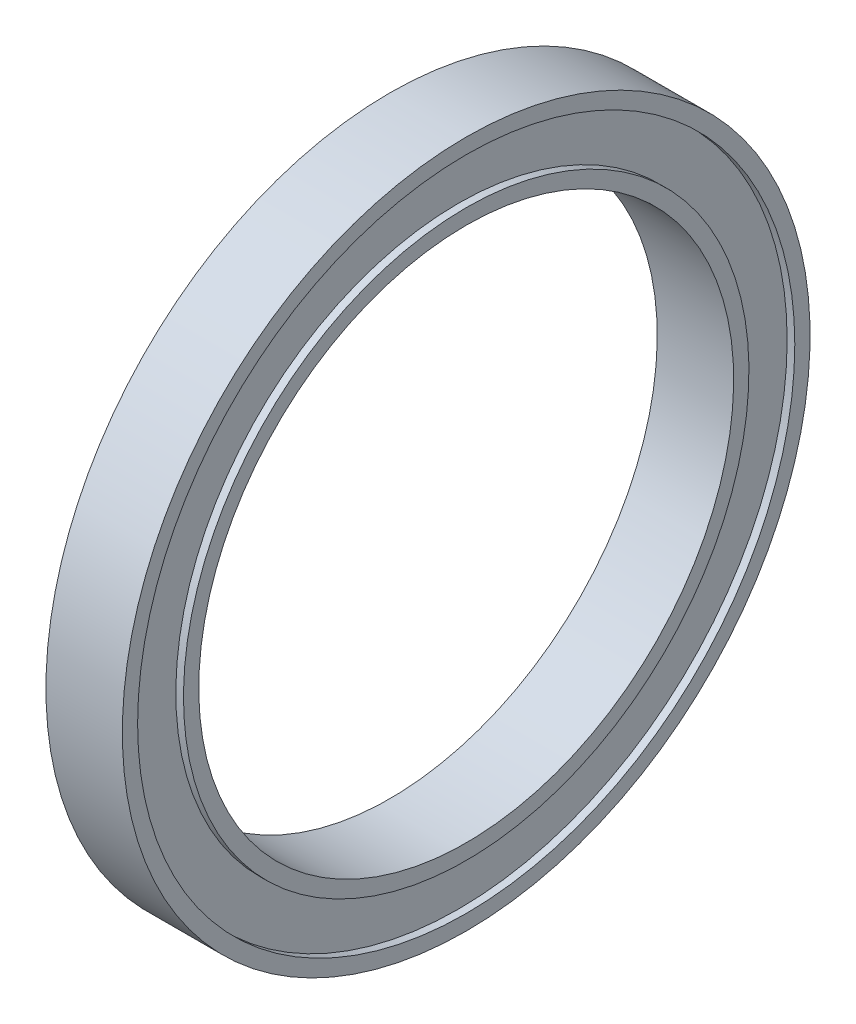
from build123d import *


with BuildPart() as part:
    # Sketch1 → Revolve1 (revolve)
    with BuildSketch(Plane.XY):
        Polygon((-5, 35), (5, 35), (5, 37), (4, 37), (4, 43), (5, 43), (5, 45), (-5, 45), (-5, 43), (-4, 43), (-4, 37), (-5, 37), align=None)
    revolve(axis=Axis((6.481208189, 0, 0), (-1, 0, 0)))


solid = part.part
